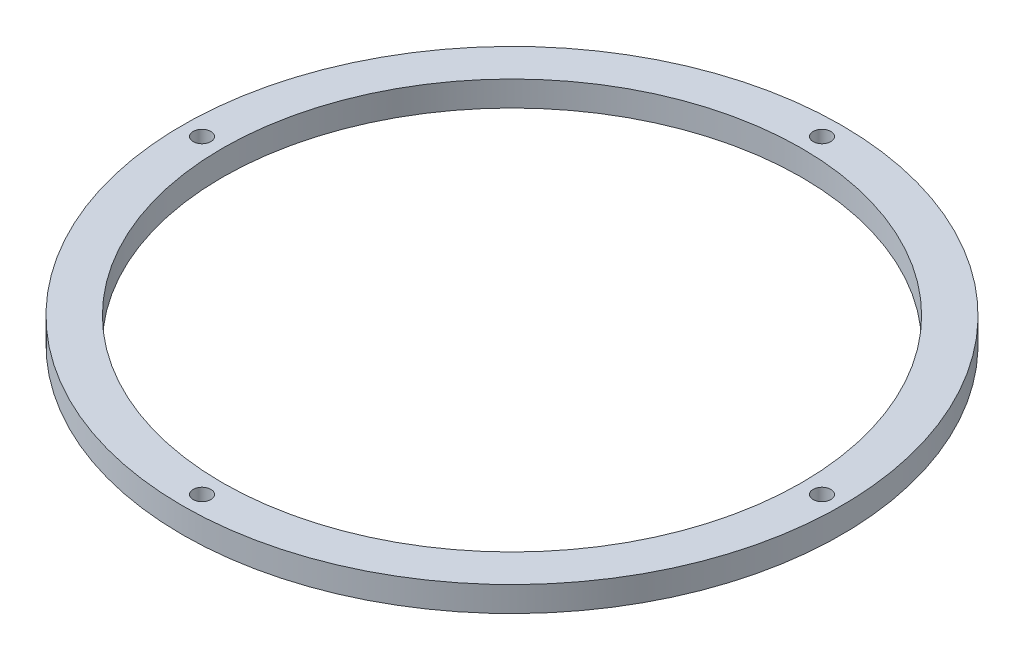
from build123d import *

# Parameters (mm, degrees)
SKETCH1_R           = 111.5
SKETCH1_R_2         = 98
BOSS_EXTRUDE1_DEPTH = 8.5
SKETCH2_R           = 3
CUT_EXTRUDE1_DEPTH  = 158.913742277


with BuildPart() as part:
    # Sketch1 → Boss-Extrude1 (new body)
    with BuildSketch(Plane(origin=(0, 0, 0), x_dir=(1, 0, 0), z_dir=(0, 1, 0))):
        Circle(SKETCH1_R)
        Circle(SKETCH1_R_2, mode=Mode.SUBTRACT)
    extrude(amount=BOSS_EXTRUDE1_DEPTH)

    # Sketch2 → Cut-Extrude1 (cut, through all)
    with BuildSketch(Plane(origin=(0, 8.5, 0), x_dir=(1, 0, 0), z_dir=(0, 1, 0))):
        with Locations((0, 104.875)):
            Circle(SKETCH2_R)
        with Locations((-104.875, 0)):
            Circle(SKETCH2_R)
        with Locations((104.875, 0)):
            Circle(SKETCH2_R)
        with Locations((0, -104.875)):
            Circle(SKETCH2_R)
    extrude(amount=-CUT_EXTRUDE1_DEPTH, mode=Mode.SUBTRACT)


solid = part.part
